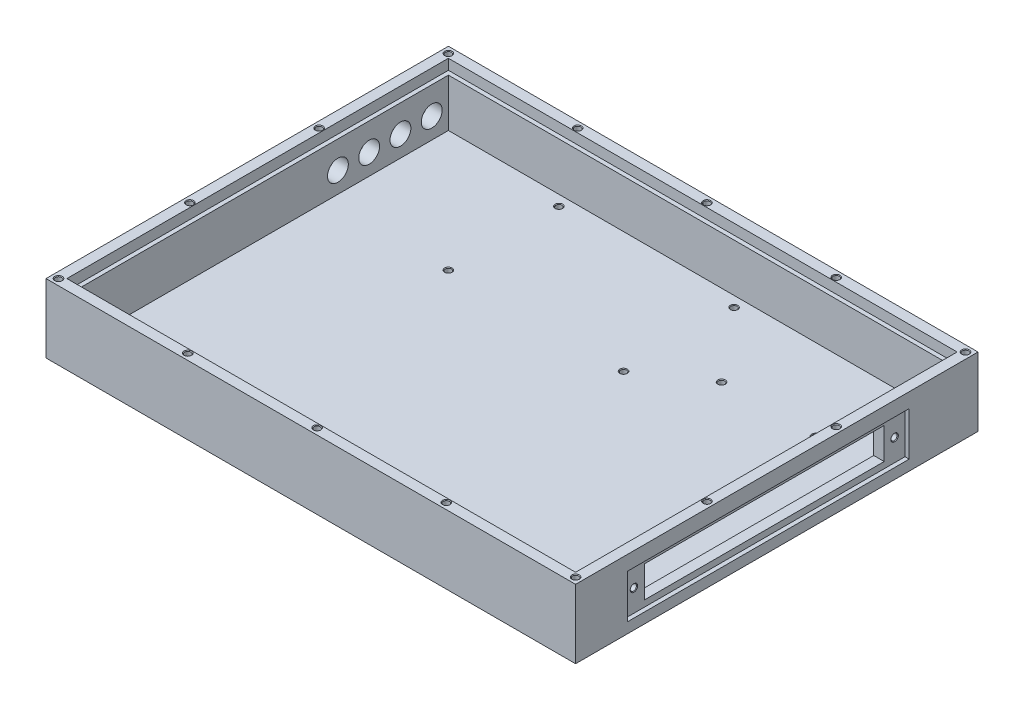
from build123d import *

# Parameters (mm, degrees)
SKETCH1_W             = 254
SKETCH1_H             = 193
BOSS_EXTRUDE1_DEPTH   = 33
SKETCH2_W             = 240
SKETCH2_H             = 179
CUT_EXTRUDE1_DEPTH    = 28
SKETCH3_W             = 244
SKETCH3_H             = 183
CUT_EXTRUDE2_DEPTH    = 5
SKETCH4_R             = 5
CUT_EXTRUDE3_DEPTH    = 268.22696346
SKETCH7_W             = 135
SKETCH7_H             = 21
CUT_EXTRUDE5_DEPTH    = 2
CUT_EXTRUDE6_REACH    = 273.855
SKETCH8_W             = 115
SKETCH8_H             = 15
SKETCH10_R            = 1.5
CUT_EXTRUDE8_DEPTH    = 3
LPATTERN9_COUNT       = 5
LPATTERN9_PITCH       = 62
LPATTERN9_COUNT_DIR2  = 2
LPATTERN9_PITCH_DIR2  = 187
LPATTERN10_COUNT      = 3
LPATTERN10_PITCH      = 62
LPATTERN10_COUNT_DIR2 = 2
LPATTERN10_PITCH_DIR2 = 248
SKETCH9_R             = 1.5
CUT_EXTRUDE7_DEPTH    = 3
SKETCH6_R             = 1.5
CUT_EXTRUDE4_DEPTH    = 3
LPATTERN11_COUNT      = 2
LPATTERN11_PITCH      = 125
LPATTERN11_COUNT_DIR2 = 2
LPATTERN11_PITCH_DIR2 = 45
SKETCH11_R            = 1.5
CUT_EXTRUDE9_DEPTH    = 3
LPATTERN12_COUNT      = 2
LPATTERN12_PITCH      = 84
LPATTERN12_COUNT_DIR2 = 2
LPATTERN12_PITCH_DIR2 = 53
CHAMFER2_SIZE         = 0.3


with BuildPart() as part:
    # Sketch1 → Boss-Extrude1 (new body)
    with BuildSketch(Plane(origin=(0, 0, 0), x_dir=(1, 0, 0), z_dir=(0, 1, 0))):
        Rectangle(SKETCH1_W, SKETCH1_H)
    extrude(amount=BOSS_EXTRUDE1_DEPTH)

    # Sketch2 → Cut-Extrude1 (cut)
    with BuildSketch(Plane(origin=(0, 33, 0), x_dir=(1, 0, 0), z_dir=(0, 1, 0))):
        Rectangle(SKETCH2_W, SKETCH2_H)
    extrude(amount=-CUT_EXTRUDE1_DEPTH, mode=Mode.SUBTRACT)

    # Sketch3 → Cut-Extrude2 (cut)
    with BuildSketch(Plane(origin=(0, 33, 0), x_dir=(1, 0, 0), z_dir=(0, 1, 0))):
        Rectangle(SKETCH3_W, SKETCH3_H)
    extrude(amount=-CUT_EXTRUDE2_DEPTH, mode=Mode.SUBTRACT)

    # Sketch4 → Cut-Extrude3 (cut, through all)
    with BuildSketch(Plane(origin=(-120, 0, 0), x_dir=(0, 0, -1), z_dir=(1, 0, 0))):
        with Locations((81.5, 15)):
            Circle(SKETCH4_R)
        with Locations((66.5, 15)):
            Circle(SKETCH4_R)
        with Locations((51.5, 15)):
            Circle(SKETCH4_R)
        with Locations((36.5, 15)):
            Circle(SKETCH4_R)
    extrude(amount=-CUT_EXTRUDE3_DEPTH, mode=Mode.SUBTRACT)

    # Sketch7 → Cut-Extrude5 (cut)
    with BuildSketch(Plane(origin=(127, 0, 0), x_dir=(0, 0, -1), z_dir=(1, 0, 0))):
        with Locations((-4, 15.5)):
            Rectangle(SKETCH7_W, SKETCH7_H)
    extrude(amount=-CUT_EXTRUDE5_DEPTH, mode=Mode.SUBTRACT)

    # Sketch8 → Cut-Extrude6 (cut, up to next)
    with BuildSketch(Plane(origin=(125, 0, 0), x_dir=(0, 0, -1), z_dir=(1, 0, 0)), mode=Mode.PRIVATE) as cut_extrude6_sk1:
        with Locations((-4, 15.5)):
            Rectangle(SKETCH8_W, SKETCH8_H)
    cut_extrude6_tool1 = extrude(cut_extrude6_sk1.sketch, amount=-CUT_EXTRUDE6_REACH, mode=Mode.PRIVATE) & part.part
    add(cut_extrude6_tool1.solids().sort_by_distance((125, 15.5, 4))[0], mode=Mode.SUBTRACT)

    # Sketch10 → Cut-Extrude8 (cut)
    with BuildSketch(Plane(origin=(0, 33, 0), x_dir=(1, 0, 0), z_dir=(0, 1, 0))):
        with Locations((-124, 93.5)):
            Circle(SKETCH10_R)
    cut_extrude8 = extrude(amount=-CUT_EXTRUDE8_DEPTH, mode=Mode.SUBTRACT)

    # LPattern9: Cut-Extrude8 5 × 2
    with Locations(*[(i * LPATTERN9_PITCH, 0, j * LPATTERN9_PITCH_DIR2) for i in range(LPATTERN9_COUNT) for j in range(LPATTERN9_COUNT_DIR2) if (i, j) != (0, 0)]):
        add(cut_extrude8, mode=Mode.SUBTRACT)

    # LPattern10: Cut-Extrude8 3 × 2
    with Locations(*[(j * LPATTERN10_PITCH_DIR2, 0, i * LPATTERN10_PITCH) for i in range(LPATTERN10_COUNT) for j in range(LPATTERN10_COUNT_DIR2) if (i, j) != (0, 0)]):
        add(cut_extrude8, mode=Mode.SUBTRACT)

    # Sketch9 → Cut-Extrude7 (cut)
    with BuildSketch(Plane(origin=(125, 0, 0), x_dir=(0, 0, -1), z_dir=(1, 0, 0))):
        with Locations((-66.5, 15.5)):
            Circle(SKETCH9_R)
        with Locations((58.5, 15.5)):
            Circle(SKETCH9_R)
    extrude(amount=-CUT_EXTRUDE7_DEPTH, mode=Mode.SUBTRACT)

    # Sketch6 → Cut-Extrude4 (cut)
    with BuildSketch(Plane(origin=(0, 5, 0), x_dir=(1, 0, 0), z_dir=(0, 1, 0))):
        with Locations((95, -74.5)):
            Circle(SKETCH6_R)
    cut_extrude4 = extrude(amount=-CUT_EXTRUDE4_DEPTH, mode=Mode.SUBTRACT)

    # LPattern11: Cut-Extrude4 2 × 2
    with Locations(*[(-j * LPATTERN11_PITCH_DIR2, 0, -i * LPATTERN11_PITCH) for i in range(LPATTERN11_COUNT) for j in range(LPATTERN11_COUNT_DIR2) if (i, j) != (0, 0)]):
        add(cut_extrude4, mode=Mode.SUBTRACT)

    # Sketch11 → Cut-Extrude9 (cut)
    with BuildSketch(Plane(origin=(0, 5, 0), x_dir=(1, 0, 0), z_dir=(0, 1, 0))):
        with Locations((22, 84.5)):
            Circle(SKETCH11_R)
    cut_extrude9 = extrude(amount=-CUT_EXTRUDE9_DEPTH, mode=Mode.SUBTRACT)

    # LPattern12: Cut-Extrude9 2 × 2
    with Locations(*[(-i * LPATTERN12_PITCH, 0, j * LPATTERN12_PITCH_DIR2) for i in range(LPATTERN12_COUNT) for j in range(LPATTERN12_COUNT_DIR2) if (i, j) != (0, 0)]):
        add(cut_extrude9, mode=Mode.SUBTRACT)

    # Chamfer2
    chamfer2_edges = [part.edges().sort_by_distance(p)[0] for p in [
        (125, 15.5, -57),
        (60.5, 33, 93.5),
        (-1.5, 33, 93.5),
        (-63.5, 33, 93.5),
        (-125.5, 33, 93.5),
        (-125.5, 33, 30.5),
        (-63.5, 5, -31.5),
        (-125.5, 33, -31.5),
        (-125.5, 33, -93.5),
        (-63.5, 5, -84.5),
        (-63.5, 33, -93.5),
        (-1.5, 33, -93.5),
        (20.5, 5, -84.5),
        (20.5, 5, -31.5),
        (48.5, 5, -50.5),
        (60.5, 33, -93.5),
        (93.5, 5, -50.5),
        (122.5, 33, -93.5),
        (122.5, 33, -31.5),
        (122.5, 33, 30.5),
        (122.5, 33, 93.5),
        (48.5, 5, 74.5),
        (93.5, 5, 74.5),
        (125, 15.5, 68),
    ]]
    chamfer(chamfer2_edges, length=CHAMFER2_SIZE)


solid = part.part
